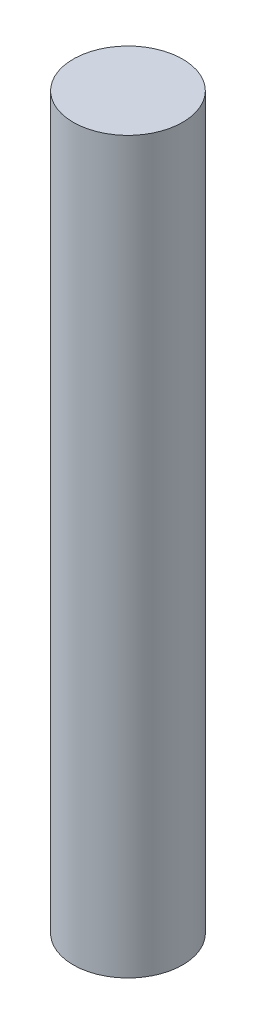
from build123d import *

# Parameters (mm, degrees)
SKETCH1_R           = 9.525
BOSS_EXTRUDE1_DEPTH = 127


with BuildPart() as part:
    # Sketch1 → Boss-Extrude1 (new body)
    with BuildSketch(Plane(origin=(0, 0, 0), x_dir=(1, 0, 0), z_dir=(0, 1, 0))):
        Circle(SKETCH1_R)
    extrude(amount=-BOSS_EXTRUDE1_DEPTH)


solid = part.part
